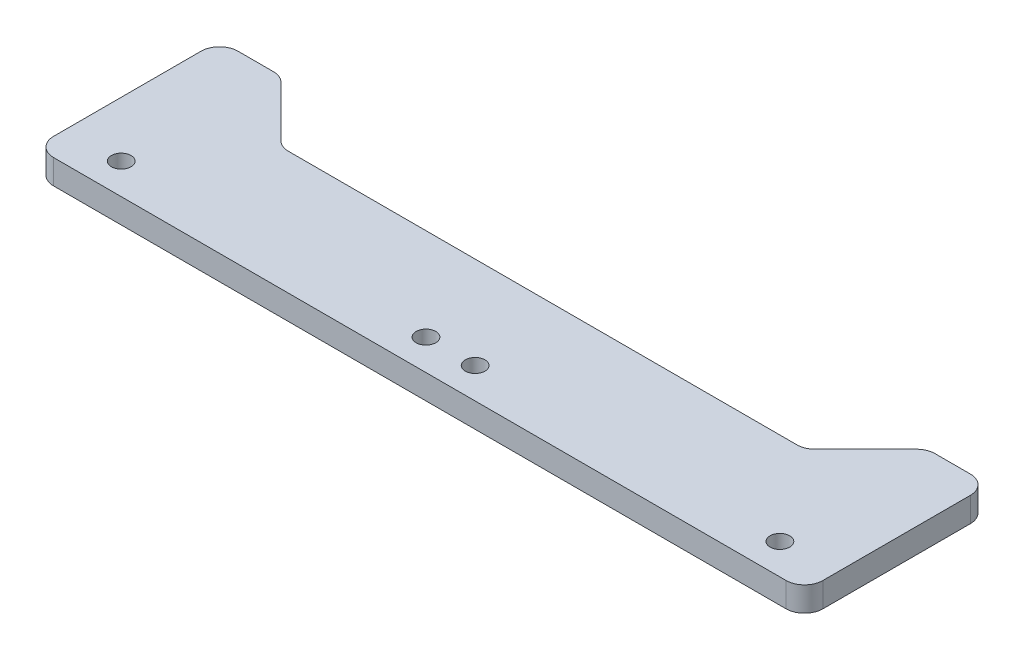
from build123d import *

# Parameters (mm, degrees)
EXTRUDE_2_DEPTH     = 4
SKETCH_6_R          = 1.6
CUT_EXTRUDE_2_DEPTH = 4
FILLET_2_R          = 3


with BuildPart() as part:
    # 草图1 → 凸台-拉伸2 (new body)
    with BuildSketch(Plane(origin=(0, 0, 0), x_dir=(1, 0, 0), z_dir=(0, 1, 0))):
        Polygon((-62.6, 15), (-52.6, 15), (-42.6, 5), (42.6, 5), (52.6, 15), (62.6, 15), (62.6, -15), (-62.6, -15), align=None)
    extrude(amount=EXTRUDE_2_DEPTH)

    # 草图6 → 切除-拉伸2 (cut)
    with BuildSketch(Plane(origin=(0, 4, 0), x_dir=(1, 0, 0), z_dir=(0, 1, 0))):
        with Locations((-53.6, -10)):
            Circle(SKETCH_6_R)
        with Locations((-4, -10)):
            Circle(SKETCH_6_R)
        with Locations((4, -10)):
            Circle(SKETCH_6_R)
        with Locations((53.6, -10)):
            Circle(SKETCH_6_R)
    extrude(amount=-CUT_EXTRUDE_2_DEPTH, mode=Mode.SUBTRACT)

    # 圆角2
    fillet_2_edges = [part.edges().sort_by_distance(p)[0] for p in [
        (62.6, 2, 15),
        (-62.6, 2, 15),
        (-52.6, 2, -15),
        (-42.6, 2, -5),
        (42.6, 2, -5),
        (52.6, 2, -15),
        (62.6, 2, -15),
        (-62.6, 2, -15),
    ]]
    fillet(fillet_2_edges, radius=FILLET_2_R)


solid = part.part
